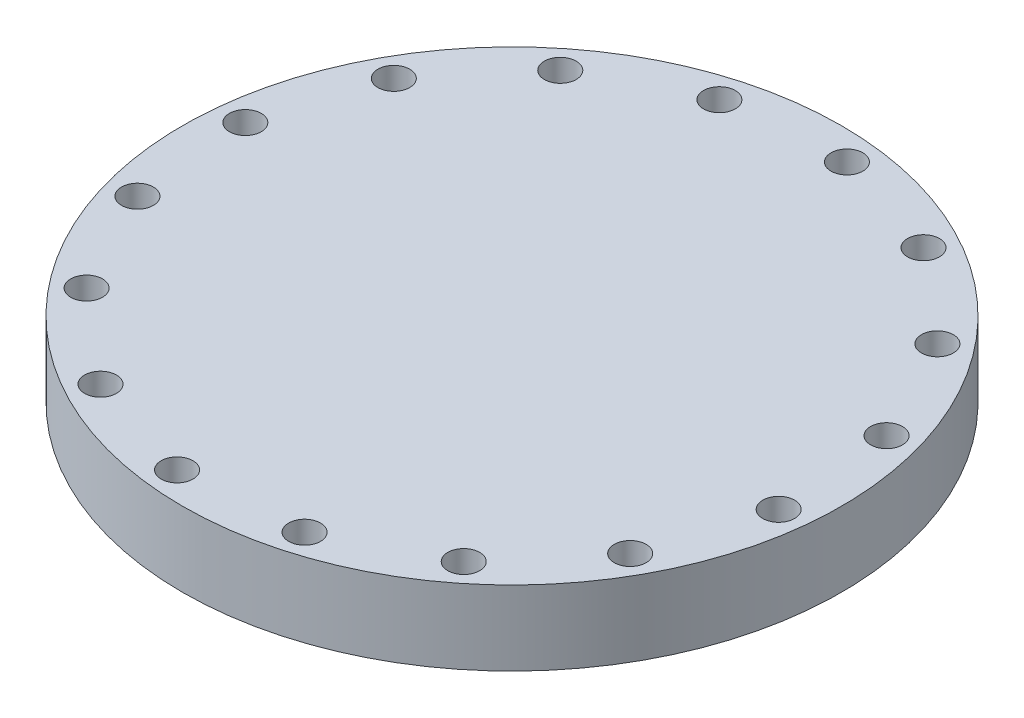
from build123d import *

# Parameters (mm, degrees)
SKETCH1_R           = 25.85370091
BOSS_EXTRUDE1_DEPTH = 2.925
CUT_EXTRUDE1_DEPTH  = 38.02769506


with BuildPart() as part:
    # Sketch1 → Boss-Extrude1 (new, symmetric)
    with BuildSketch(Plane(origin=(0, 0, 0), x_dir=(1, 0, 0), z_dir=(0, 1, 0))):
        Circle(SKETCH1_R)
    extrude(amount=BOSS_EXTRUDE1_DEPTH, both=True)

    # Sketch2 → Cut-Extrude1 (cut, through all)
    with BuildSketch(Plane.XZ.offset(2.925)):
        with BuildLine():
            ThreePointArc((22.019698731, -5.602620776), (21.872491194, -7.364247848), (23.634118266, -7.511455385))
            ThreePointArc((23.634118266, -7.511455385), (23.781325803, -5.749828313), (22.019698731, -5.602620776))
        make_face()
        with BuildLine():
            ThreePointArc((22.791373624, 3.631983723), (22.644166087, 1.87035665), (24.405793159, 1.723149114))
            ThreePointArc((24.405793159, 1.723149114), (24.553000696, 3.484776186), (22.791373624, 3.631983723))
        make_face()
        with BuildLine():
            ThreePointArc((17.772833946, -13.838975667), (17.625626409, -15.600602739), (19.387253481, -15.747810276))
            ThreePointArc((19.387253481, -15.747810276), (19.534461018, -13.986183203), (17.772833946, -13.838975667))
        make_face()
        with BuildLine():
            ThreePointArc((10.697325934, -19.82317058), (10.550118397, -21.584797652), (12.311745469, -21.732005189))
            ThreePointArc((12.311745469, -21.732005189), (12.458953006, -19.970378117), (10.697325934, -19.82317058))
        make_face()
        with BuildLine():
            ThreePointArc((1.87035665, -22.644166087), (1.723149114, -24.405793159), (3.484776186, -24.553000696))
            ThreePointArc((3.484776186, -24.553000696), (3.631983723, -22.791373624), (1.87035665, -22.644166087))
        make_face()
        with BuildLine():
            ThreePointArc((-7.364247848, -21.872491194), (-7.511455385, -23.634118266), (-5.749828313, -23.781325803))
            ThreePointArc((-5.749828313, -23.781325803), (-5.602620776, -22.019698731), (-7.364247848, -21.872491194))
        make_face()
        with BuildLine():
            ThreePointArc((-15.600602739, -17.625626409), (-15.747810276, -19.387253481), (-13.986183203, -19.534461018))
            ThreePointArc((-13.986183203, -19.534461018), (-13.838975667, -17.772833946), (-15.600602739, -17.625626409))
        make_face()
        with BuildLine():
            ThreePointArc((-21.584797652, -10.550118397), (-21.732005189, -12.311745469), (-19.970378117, -12.458953006))
            ThreePointArc((-19.970378117, -12.458953006), (-19.82317058, -10.697325934), (-21.584797652, -10.550118397))
        make_face()
        with BuildLine():
            ThreePointArc((-24.405793159, -1.723149114), (-24.553000696, -3.484776186), (-22.791373624, -3.631983723))
            ThreePointArc((-22.791373624, -3.631983723), (-22.644166087, -1.87035665), (-24.405793159, -1.723149114))
        make_face()
        with BuildLine():
            ThreePointArc((-23.634118266, 7.511455385), (-23.781325803, 5.749828313), (-22.019698731, 5.602620776))
            ThreePointArc((-22.019698731, 5.602620776), (-21.872491194, 7.364247848), (-23.634118266, 7.511455385))
        make_face()
        with BuildLine():
            ThreePointArc((-19.387253481, 15.747810276), (-19.534461018, 13.986183203), (-17.772833946, 13.838975667))
            ThreePointArc((-17.772833946, 13.838975667), (-17.625626409, 15.600602739), (-19.387253481, 15.747810276))
        make_face()
        with BuildLine():
            ThreePointArc((-12.311745469, 21.732005189), (-12.458953006, 19.970378117), (-10.697325934, 19.82317058))
            ThreePointArc((-10.697325934, 19.82317058), (-10.550118397, 21.584797652), (-12.311745469, 21.732005189))
        make_face()
        with BuildLine():
            ThreePointArc((-3.484776186, 24.553000696), (-3.631983723, 22.791373624), (-1.87035665, 22.644166087))
            ThreePointArc((-1.87035665, 22.644166087), (-1.723149114, 24.405793159), (-3.484776186, 24.553000696))
        make_face()
        with BuildLine():
            ThreePointArc((5.749828313, 23.781325803), (5.602620776, 22.019698731), (7.364247848, 21.872491194))
            ThreePointArc((7.364247848, 21.872491194), (7.511455385, 23.634118266), (5.749828313, 23.781325803))
        make_face()
        with BuildLine():
            ThreePointArc((19.970378117, 12.458953006), (19.82317058, 10.697325934), (21.584797652, 10.550118397))
            ThreePointArc((21.584797652, 10.550118397), (21.732005189, 12.311745469), (19.970378117, 12.458953006))
        make_face()
        with BuildLine():
            ThreePointArc((13.986183203, 19.534461018), (13.838975667, 17.772833946), (15.600602739, 17.625626409))
            ThreePointArc((15.600602739, 17.625626409), (15.747810276, 19.387253481), (13.986183203, 19.534461018))
        make_face()
    extrude(amount=-CUT_EXTRUDE1_DEPTH, mode=Mode.SUBTRACT)


solid = part.part
